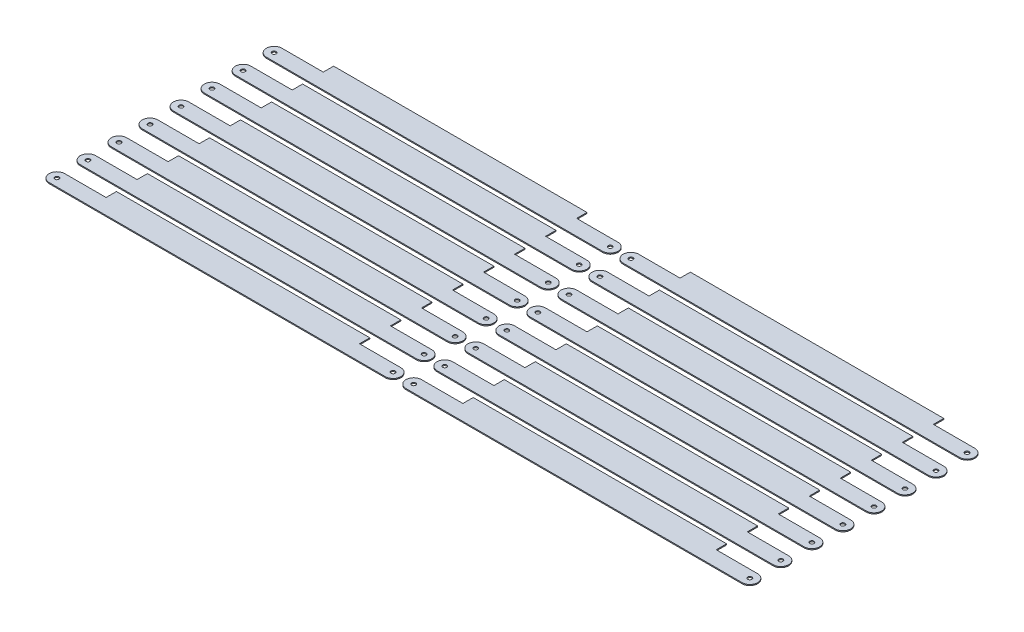
from build123d import *

# Parameters (mm, degrees)
SKETCH1_R           = 2
BOSS_EXTRUDE1_DEPTH = 1
LPATTERN1_COUNT     = 8
LPATTERN1_PITCH     = 30
LPATTERN1_2_COUNT   = 2
LPATTERN1_2_PITCH   = 345


with BuildPart() as part:
    # Sketch1 → Boss-Extrude1 (new body)
    with BuildSketch(Plane(origin=(0, 0, 0), x_dir=(1, 0, 0), z_dir=(0, 1, 0))):
        with BuildLine():
            Line((5, 7.5), (0, 7.5))
            ThreePointArc((0, 7.5), (-4.937104415, 5.645794895), (-7.433034374, 1))
            Line((-7.433034374, 1), (-7.5, 1))
            Line((-7.5, 1), (-7.5, -1))
            Line((-7.5, -1), (-7.433034374, -1))
            ThreePointArc((-7.433034374, -1), (-4.937104415, -5.645794895), (0, -7.5))
            Line((0, -7.5), (325, -7.5))
            ThreePointArc((325, -7.5), (329.937104415, -5.645794895), (332.433034374, -1))
            Line((332.433034374, -1), (332.5, -1))
            Line((332.5, -1), (332.5, 1))
            Line((332.5, 1), (332.433034374, 1))
            ThreePointArc((332.433034374, 1), (329.937104415, 5.645794895), (325, 7.5))
            Line((325, 7.5), (285, 7.5))
            Line((285, 7.5), (285, 17.5))
            Line((285, 17.5), (40, 17.5))
            Line((40, 17.5), (40, 7.5))
            Line((40, 7.5), (5, 7.5))
        make_face()
        Circle(SKETCH1_R, mode=Mode.SUBTRACT)
        with Locations((325, 0)):
            Circle(SKETCH1_R, mode=Mode.SUBTRACT)
    extrude(amount=BOSS_EXTRUDE1_DEPTH)


with BuildPart() as lpattern1_1:
    # LPattern1: pattern copy
    add(part.part.moved(Location(Vector(0, 0, -1) * (1 * LPATTERN1_PITCH))))


with BuildPart() as lpattern1_2:
    # LPattern1: pattern copy
    add(part.part.moved(Location(Vector(0, 0, -1) * (2 * LPATTERN1_PITCH))))


with BuildPart() as lpattern1_3:
    # LPattern1: pattern copy
    add(part.part.moved(Location(Vector(0, 0, -1) * (3 * LPATTERN1_PITCH))))


with BuildPart() as lpattern1_4:
    # LPattern1: pattern copy
    add(part.part.moved(Location(Vector(0, 0, -1) * (4 * LPATTERN1_PITCH))))


with BuildPart() as lpattern1_5:
    # LPattern1: pattern copy
    add(part.part.moved(Location(Vector(0, 0, -1) * (5 * LPATTERN1_PITCH))))


with BuildPart() as lpattern1_6:
    # LPattern1: pattern copy
    add(part.part.moved(Location(Vector(0, 0, -1) * (6 * LPATTERN1_PITCH))))


with BuildPart() as lpattern1_7:
    # LPattern1: pattern copy
    add(part.part.moved(Location(Vector(0, 0, -1) * (7 * LPATTERN1_PITCH))))


with BuildPart() as lpattern1_2_1:
    # LPattern1 2: pattern copy
    add(part.part.moved(Location(Vector(1, 0, 0) * (1 * LPATTERN1_2_PITCH))))


with BuildPart() as lpattern1_2_2:
    # LPattern1 2: pattern copy
    add(lpattern1_1.part.moved(Location(Vector(1, 0, 0) * (1 * LPATTERN1_2_PITCH))))


with BuildPart() as lpattern1_2_3:
    # LPattern1 2: pattern copy
    add(lpattern1_2.part.moved(Location(Vector(1, 0, 0) * (1 * LPATTERN1_2_PITCH))))


with BuildPart() as lpattern1_2_4:
    # LPattern1 2: pattern copy
    add(lpattern1_3.part.moved(Location(Vector(1, 0, 0) * (1 * LPATTERN1_2_PITCH))))


with BuildPart() as lpattern1_2_5:
    # LPattern1 2: pattern copy
    add(lpattern1_4.part.moved(Location(Vector(1, 0, 0) * (1 * LPATTERN1_2_PITCH))))


with BuildPart() as lpattern1_2_6:
    # LPattern1 2: pattern copy
    add(lpattern1_5.part.moved(Location(Vector(1, 0, 0) * (1 * LPATTERN1_2_PITCH))))


with BuildPart() as lpattern1_2_7:
    # LPattern1 2: pattern copy
    add(lpattern1_6.part.moved(Location(Vector(1, 0, 0) * (1 * LPATTERN1_2_PITCH))))


with BuildPart() as lpattern1_2_8:
    # LPattern1 2: pattern copy
    add(lpattern1_7.part.moved(Location(Vector(1, 0, 0) * (1 * LPATTERN1_2_PITCH))))


solid = Compound([part.part, lpattern1_1.part, lpattern1_2.part, lpattern1_3.part, lpattern1_4.part, lpattern1_5.part, lpattern1_6.part, lpattern1_7.part, lpattern1_2_1.part, lpattern1_2_2.part, lpattern1_2_3.part, lpattern1_2_4.part, lpattern1_2_5.part, lpattern1_2_6.part, lpattern1_2_7.part, lpattern1_2_8.part])
